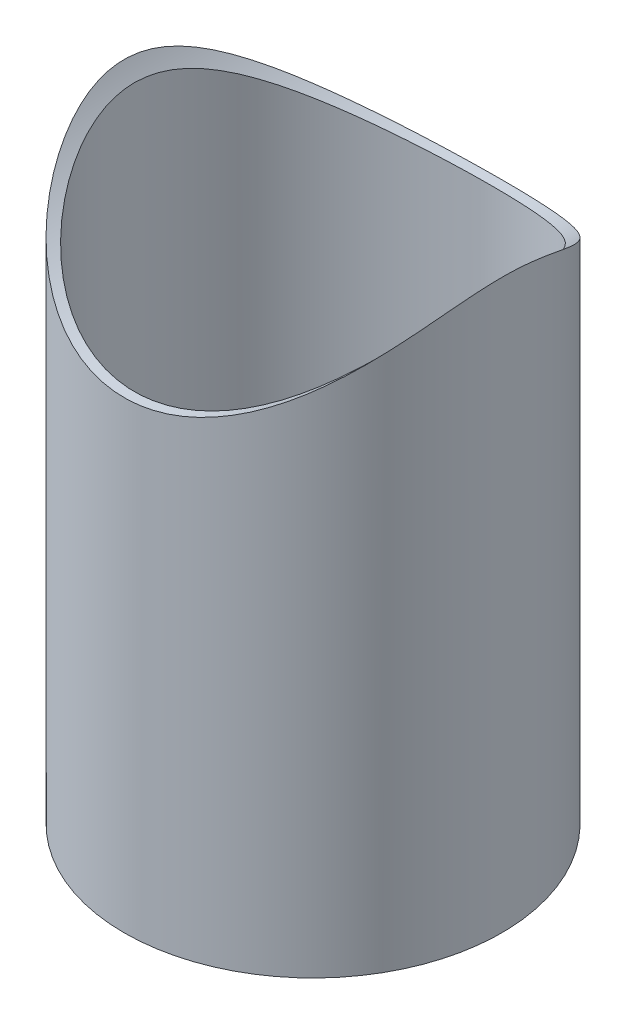
from build123d import *

# Parameters (mm, degrees)
SKETCH_1_R               = 55
EXTRUDE_1_DEPTH          = 200
SHELL_1_OUTLINE_R        = 52
SHELL_1_DEPTH            = 200
CUT_EXTRUDE_1_DEPTH      = 215.592637339
CUT_EXTRUDE_1_DEPTH_BACK = 215.592637339
SKETCH_2_R               = 65


# Read off the part's stored shape, not the designer's step: Оболочка1
with BuildPart() as part:
    # Эскиз1 → Бобышка-Вытянуть1 (new body)
    with BuildSketch(Plane(origin=(0, 0, 0), x_dir=(1, 0, 0), z_dir=(0, 1, 0))):
        with Locations(Location((0, 0, 0), (0, 0, 270))):
            Circle(SKETCH_1_R)
    extrude(amount=EXTRUDE_1_DEPTH)

    # Оболочка1 outline → Оболочка1 (cut)
    with BuildSketch(Plane(origin=(0, 0, 0), x_dir=(1, 0, 0), z_dir=(0, 1, 0))):
        Circle(SHELL_1_OUTLINE_R)
    extrude(amount=SHELL_1_DEPTH, mode=Mode.SUBTRACT)

    # Эскиз2 → Вырез-Вытянуть1 (cut, two sides: drawn at the far end of the back side and taken through both)
    with BuildSketch(Plane.XY.offset(-CUT_EXTRUDE_1_DEPTH_BACK)):
        with Locations((0, 200)):
            Circle(SKETCH_2_R)
    extrude(amount=CUT_EXTRUDE_1_DEPTH + CUT_EXTRUDE_1_DEPTH_BACK, mode=Mode.SUBTRACT)


solid = part.part
